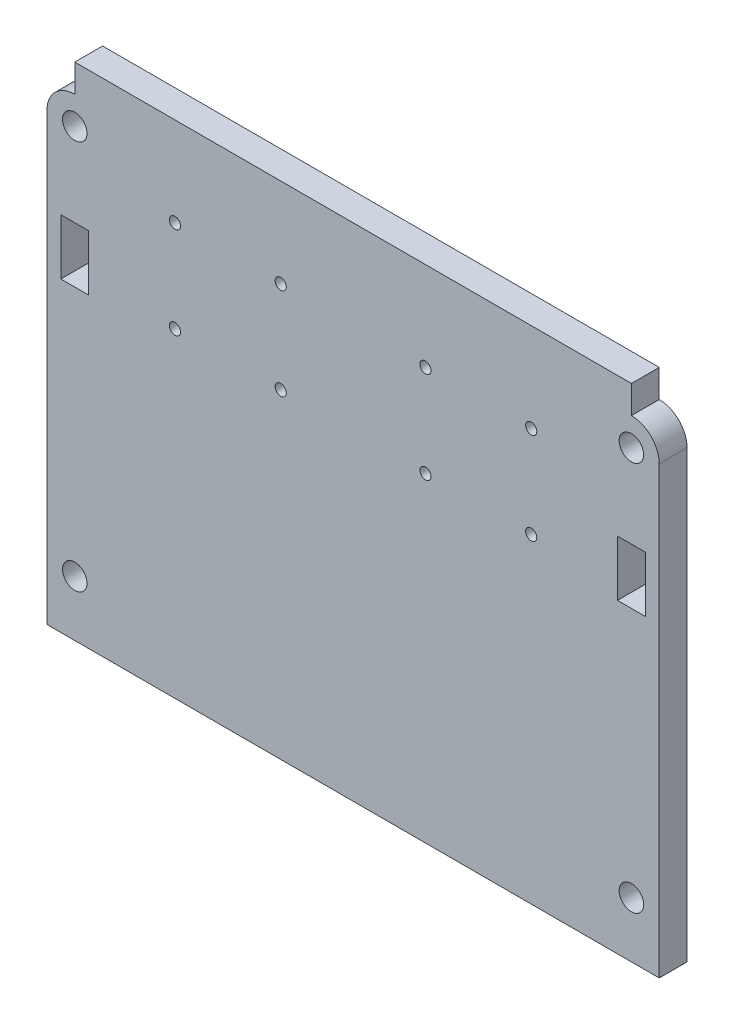
from build123d import *

# Parameters (mm, degrees)
SKETCH1_R           = 2.2
BOSS_EXTRUDE1_DEPTH = 5
SKETCH2_R           = 1
CUT_EXTRUDE1_DEPTH  = 153.151240547


with BuildPart() as part:
    # Sketch1 → Boss-Extrude1 (new body)
    with BuildSketch(Plane.XY):
        with BuildLine():
            Line((0, 105), (0, 110))
            Line((0, 110), (100, 110))
            Line((100, 110), (100, 105))
            ThreePointArc((100, 105), (103.535533906, 103.535533906), (105, 100))
            Line((105, 100), (105, 20))
            Line((105, 20), (100, 20))
            Line((100, 20), (0, 20))
            Line((0, 20), (-5, 20))
            Line((-5, 20), (-5, 100))
            ThreePointArc((-5, 100), (-3.535533906, 103.535533906), (0, 105))
        make_face()
        with Locations((0, 100)):
            Circle(SKETCH1_R, mode=Mode.SUBTRACT)
        with Locations((0, 30)):
            Circle(SKETCH1_R, mode=Mode.SUBTRACT)
        with Locations((100, 30)):
            Circle(SKETCH1_R, mode=Mode.SUBTRACT)
        with Locations((100, 100)):
            Circle(SKETCH1_R, mode=Mode.SUBTRACT)
        Polygon((0, 85), (2.5, 85), (2.5, 75), (0, 75), (-2.5, 75), (-2.5, 85), align=None, mode=Mode.SUBTRACT)
        Polygon((102.5, 75), (100, 75), (97.5, 75), (97.5, 85), (100, 85), (102.5, 85), align=None, mode=Mode.SUBTRACT)
    extrude(amount=BOSS_EXTRUDE1_DEPTH)

    # Sketch2 → Cut-Extrude1 (cut, through all)
    with BuildSketch(Plane.XY.offset(5)):
        with Locations((18, 94)):
            Circle(SKETCH2_R)
        with Locations((37, 94)):
            Circle(SKETCH2_R)
        with Locations((18, 77.5)):
            Circle(SKETCH2_R)
        with Locations((37, 77.5)):
            Circle(SKETCH2_R)
        with Locations((63, 77.5)):
            Circle(SKETCH2_R)
        with Locations((82, 77.5)):
            Circle(SKETCH2_R)
        with Locations((63, 94)):
            Circle(SKETCH2_R)
        with Locations((82, 94)):
            Circle(SKETCH2_R)
    extrude(amount=-CUT_EXTRUDE1_DEPTH, mode=Mode.SUBTRACT)


solid = part.part
